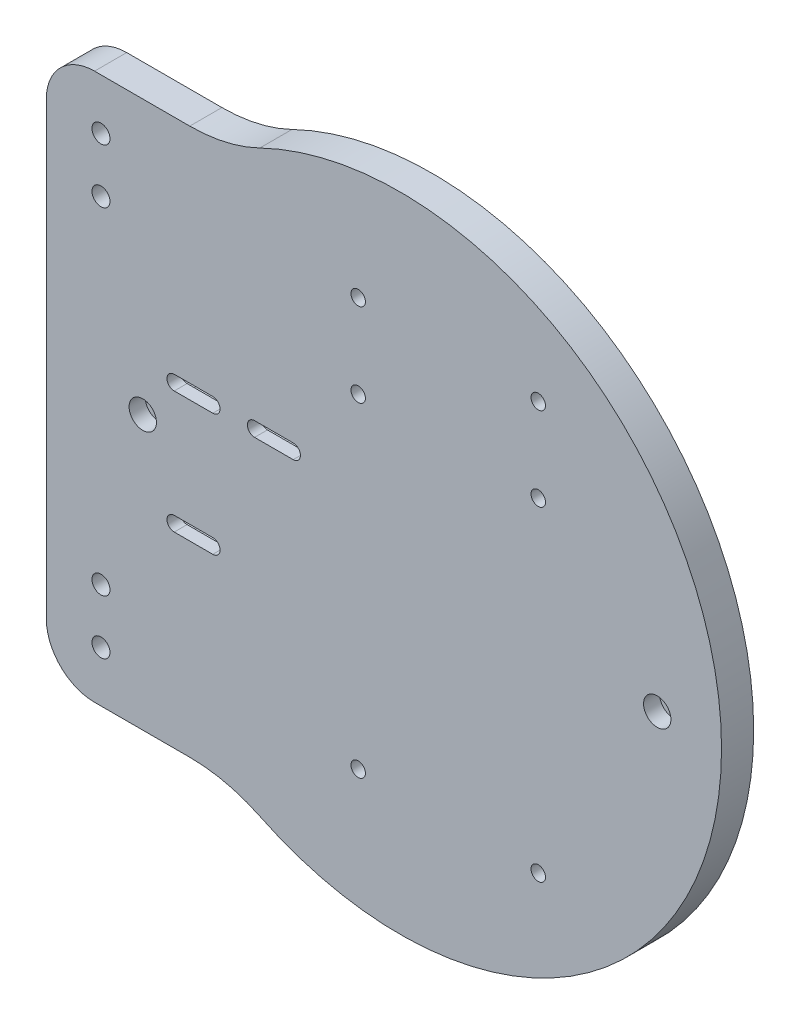
from build123d import *

# Parameters (mm, degrees)
SALIENTE_EXTRUIR2_DEPTH                              = 10
REDONDEO3_R                                          = 15
REDONDEO5_R                                          = 50
CROQUIS4_R                                           = 2.800000001
CROQUIS4_R_2                                         = 2.25
CORTAR_EXTRUIR1_DEPTH                                = 149.996644258
REFRENTADO_PARA_TORNILLO_CON_CABEZA_TRON_D           = 4.5
REFRENTADO_PARA_TORNILLO_CON_CABEZA_TRON_CBORE_D     = 8.5
REFRENTADO_PARA_TORNILLO_CON_CABEZA_TRON_CBORE_DEPTH = 5
CORTAR_EXTRUIR2_DEPTH                                = 6


with BuildPart() as part:
    # Croquis2 → Saliente-Extruir2 (new body)
    with BuildSketch(Plane(origin=(0, 0, 0), x_dir=(0, 1, 0), z_dir=(0, 0, 1))):
        with BuildLine():
            Line((-85, 52.678268764), (-85, 110))
            Line((-85, 110), (85, 110))
            Line((85, 110), (85, 52.678268764))
            ThreePointArc((85, 52.678268764), (0, -100), (-85, 52.678268764))
        make_face()
    extrude(amount=SALIENTE_EXTRUIR2_DEPTH)

    # Redondeo3
    redondeo3_edges = [part.edges().sort_by_distance(p)[0] for p in [
        (-110, 85, 5),
        (-110, -85, 5),
    ]]
    fillet(redondeo3_edges, radius=REDONDEO3_R)

    # Redondeo5
    redondeo5_edges = [part.edges().sort_by_distance(p)[0] for p in [
        (-52.678268764, 85, 5),
        (-52.678268764, -85, 5),
    ]]
    fillet(redondeo5_edges, radius=REDONDEO5_R)

    # Croquis4 → Cortar-Extruir1 (cut, through all)
    with BuildSketch(Plane.XY.offset(10)):
        with Locations((-93, 69.199999997)):
            Circle(CROQUIS4_R)
        with Locations((-93, 52.279001064)):
            Circle(CROQUIS4_R)
        with Locations((-93, -52.279001071)):
            Circle(CROQUIS4_R)
        with Locations((-93, -69.200000003)):
            Circle(CROQUIS4_R)
        with Locations((-13, 39)):
            Circle(CROQUIS4_R_2)
        with Locations((43, 39)):
            Circle(CROQUIS4_R_2)
        with Locations((-13, 65)):
            Circle(CROQUIS4_R_2)
        with Locations((43, 65)):
            Circle(CROQUIS4_R_2)
        with Locations((-13, -62)):
            Circle(CROQUIS4_R_2)
        with Locations((43, -62)):
            Circle(CROQUIS4_R_2)
        with BuildLine():
            Line((-58.219532094, 11.25), (-70.219532094, 11.25))
            ThreePointArc((-70.219532094, 11.25), (-72.469532094, 13.5), (-70.219532094, 15.75))
            Line((-70.219532094, 15.75), (-58.219532094, 15.75))
            ThreePointArc((-58.219532094, 15.75), (-55.969532094, 13.5), (-58.219532094, 11.25))
        make_face()
        with BuildLine():
            Line((-33.219532094, 11.25), (-45.219532094, 11.25))
            ThreePointArc((-45.219532094, 11.25), (-47.469532094, 13.5), (-45.219532094, 15.75))
            Line((-45.219532094, 15.75), (-33.219532094, 15.75))
            ThreePointArc((-33.219532094, 15.75), (-30.969532094, 13.5), (-33.219532094, 11.25))
        make_face()
        with BuildLine():
            Line((-58.219532094, -26.75), (-70.219532094, -26.75))
            ThreePointArc((-70.219532094, -26.75), (-72.469532094, -24.5), (-70.219532094, -22.25))
            Line((-70.219532094, -22.25), (-58.219532094, -22.25))
            ThreePointArc((-58.219532094, -22.25), (-55.969532094, -24.5), (-58.219532094, -26.75))
        make_face()
    extrude(amount=-CORTAR_EXTRUIR1_DEPTH, mode=Mode.SUBTRACT)

    # Refrentado para tornillo con cabeza troncocónica de M41 (through all)
    with Locations(Plane.XY.offset(10)):
        with Locations((-80, 0), (80, 0)):
            CounterBoreHole(REFRENTADO_PARA_TORNILLO_CON_CABEZA_TRON_D / 2, REFRENTADO_PARA_TORNILLO_CON_CABEZA_TRON_CBORE_D / 2, REFRENTADO_PARA_TORNILLO_CON_CABEZA_TRON_CBORE_DEPTH)

    # Croquis7 → Cortar-Extruir2 (cut)
    with BuildSketch(Plane(origin=(0, 0, 0), x_dir=(1, 0, 0), z_dir=(0, 0, -1))):
        with BuildLine():
            Line((-70.219532094, 29), (-58.219532094, 29))
            ThreePointArc((-58.219532094, 29), (-53.719532094, 24.5), (-58.219532094, 20))
            Line((-58.219532094, 20), (-70.219532094, 20))
            ThreePointArc((-70.219532094, 20), (-74.719532094, 24.5), (-70.219532094, 29))
        make_face()
        with BuildLine():
            Line((-70.219532094, -9), (-58.219532094, -9))
            ThreePointArc((-58.219532094, -9), (-53.719532094, -13.5), (-58.219532094, -18))
            Line((-58.219532094, -18), (-70.219532094, -18))
            ThreePointArc((-70.219532094, -18), (-74.719532094, -13.5), (-70.219532094, -9))
        make_face()
        with BuildLine():
            Line((-45.219532094, -9), (-33.219532094, -9))
            ThreePointArc((-33.219532094, -9), (-28.719532094, -13.5), (-33.219532094, -18))
            Line((-33.219532094, -18), (-45.219532094, -18))
            ThreePointArc((-45.219532094, -18), (-49.719532094, -13.5), (-45.219532094, -9))
        make_face()
    extrude(amount=-CORTAR_EXTRUIR2_DEPTH, mode=Mode.SUBTRACT)


solid = part.part
